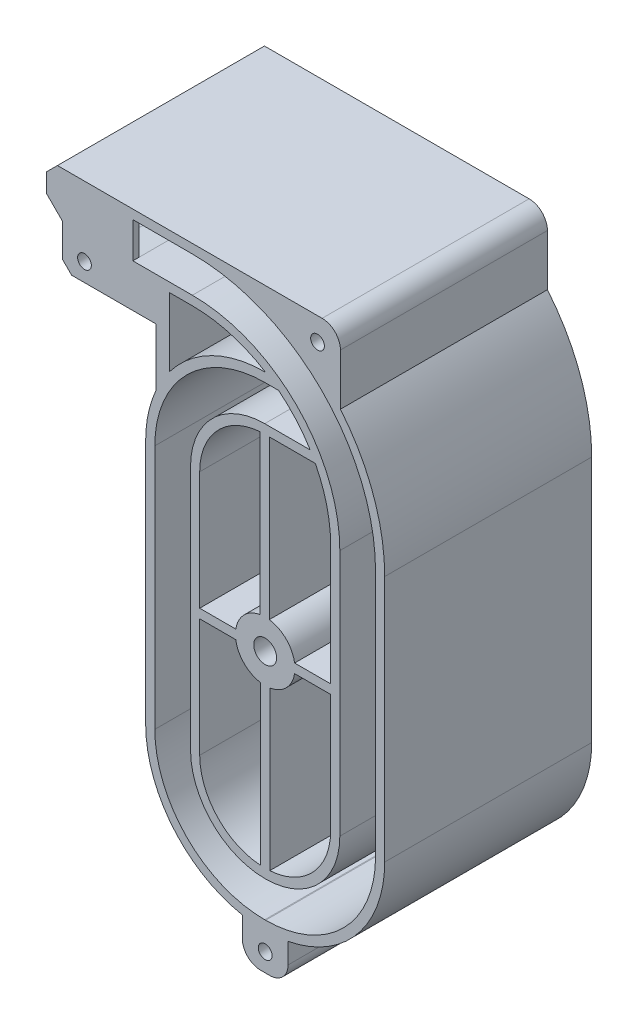
from build123d import *

# Parameters (mm, degrees)
BOSS_EXTRUDE6_DEPTH      = 22.6
BOSS_EXTRUDE6_DEPTH_BACK = 22.6
SKETCH9_R                = 1.5
BOSS_EXTRUDE7_START      = -22.6
BOSS_EXTRUDE7_OUTLINE_R  = 2.5
BOSS_EXTRUDE7_DEPTH      = 45.2
CUT_EXTRUDE1_DEPTH       = 21.2
CUT_EXTRUDE1_DEPTH_BACK  = 21.2
SKETCH9_30_R             = 1.5
BOSS_EXTRUDE8_DEPTH      = 22.6
BOSS_EXTRUDE8_DEPTH_BACK = 22.6
SKETCH9_31_R             = 1.5
FILLET1_R                = 4
CHAMFER1_SIZE            = 2
CHAMFER2_SIZE            = 10
SKETCH11_R               = 2.5
CUT_EXTRUDE5_DEPTH       = 4


# Read off the part's stored shape, not the designer's step: Boss-Extrude7
with BuildPart() as part:
    # Sketch9 → Boss-Extrude6 (new, two sides: drawn at the far end of the back side and taken through both)
    with BuildSketch(Plane.XY.offset(-BOSS_EXTRUDE6_DEPTH_BACK)):
        Polygon((10.55, -1.2), (30.962513099, -1.2), (30.962513099, 6.2), (25.90954056, 6.2), (25.90954056, 8.2), (25.90954056, 18), (9.45, 18), (7.014466094, 15.564466094), (7.014466094, 11.55), (10.55, 8.014466094), align=None)
        with Locations((15.35, 2.8)):
            Circle(SKETCH9_R, mode=Mode.SUBTRACT)
    extrude(amount=BOSS_EXTRUDE6_DEPTH + BOSS_EXTRUDE6_DEPTH_BACK)

    # Boss-Extrude7 outline → Boss-Extrude7 (add)
    with BuildSketch(Plane.XY.offset(BOSS_EXTRUDE7_START)):
        with BuildLine():
            Line((38.90954056, 18), (25.90954056, 18))
            Line((25.90954056, 18), (25.90954056, 16))
            Line((25.90954056, 16), (38.90954056, 16))
            ThreePointArc((38.90954056, 16), (67.193811807, 4.284271247), (78.90954056, -24))
            Line((78.90954056, -24), (78.90954056, -78))
            ThreePointArc((78.90954056, -78), (71.880103308, -94.970562748), (54.90954056, -102))
            Line((54.90954056, -102), (54.709540559, -102))
            ThreePointArc((54.709540559, -102), (37.738977811, -94.970562748), (30.709540559, -78))
            Line((30.709540559, -78), (30.709540559, -24.386722193))
            ThreePointArc((30.709540559, -24.386722193), (37.738977811, -7.416159445), (54.709540559, -0.386722193))
            Line((54.709540559, -0.386722193), (57.736465726, -0.386722193))
            ThreePointArc((57.736465726, -0.386722193), (61.526284336, -3.986931746), (64.638517317, -8.186722193))
            Line((64.638517317, -8.186722193), (54.709540559, -8.186722193))
            ThreePointArc((54.709540559, -8.186722193), (43.254410704, -12.931592338), (38.509540559, -24.386722193))
            Line((38.509540559, -24.386722193), (38.509540559, -78))
            ThreePointArc((38.509540559, -78), (43.254410704, -89.455129855), (54.709540559, -94.2))
            Line((54.709540559, -94.2), (54.90954056, -94.2))
            ThreePointArc((54.90954056, -94.2), (66.364670415, -89.455129855), (71.10954056, -78))
            Line((71.10954056, -78), (71.10954056, -24))
            ThreePointArc((71.10954056, -24), (61.678378914, -1.231161646), (38.90954056, 8.2))
            Line((38.90954056, 8.2), (25.90954056, 8.2))
            Line((25.90954056, 8.2), (25.90954056, 6.2))
            Line((25.90954056, 6.2), (30.962513099, 6.2))
            Line((30.962513099, 6.2), (30.962513099, -13.8))
            ThreePointArc((30.962513099, -13.8), (29.279020372, -18.974823911), (28.709540559, -24.386722193))
            Line((28.709540559, -24.386722193), (28.709540559, -78))
            ThreePointArc((28.709540559, -78), (36.324764249, -96.384776311), (54.709540559, -104))
            Line((54.709540559, -104), (54.90954056, -104))
            ThreePointArc((54.90954056, -104), (73.29431687, -96.384776311), (80.90954056, -78))
            Line((80.90954056, -78), (80.90954056, -24))
            ThreePointArc((80.90954056, -24), (68.608025369, 5.69848481), (38.90954056, 18))
        make_face()
        with BuildLine():
            Line((40.509540559, -78), (40.509540559, -52.193361097))
            Line((40.509540559, -52.193361097), (48.38692427, -52.193361097))
            ThreePointArc((48.38692427, -52.193361097), (50.213346482, -55.789555174), (53.809540559, -57.615977386))
            Line((53.809540559, -57.615977386), (53.809540559, -92.171450173))
            ThreePointArc((53.809540559, -92.171450173), (44.355314369, -87.717509969), (40.509540559, -78))
        make_face(mode=Mode.SUBTRACT)
        with BuildLine():
            Line((61.232156849, -52.193361097), (69.10954056, -52.193361097))
            Line((69.10954056, -52.193361097), (69.10954056, -78))
            ThreePointArc((69.10954056, -78), (65.26376675, -87.717509969), (55.80954056, -92.171450173))
            Line((55.80954056, -92.171450173), (55.809540559, -57.615977386))
            ThreePointArc((55.809540559, -57.615977386), (59.405734637, -55.789555174), (61.232156849, -52.193361097))
        make_face(mode=Mode.SUBTRACT)
        with Locations((54.809540559, -51.193361097)):
            Circle(BOSS_EXTRUDE7_OUTLINE_R, mode=Mode.SUBTRACT)
        with BuildLine():
            Line((48.38692427, -50.193361097), (40.509540559, -50.193361097))
            Line((40.509540559, -50.193361097), (40.509540559, -24.386722193))
            ThreePointArc((40.509540559, -24.386722193), (44.321085429, -14.705813145), (53.709540559, -10.221977225))
            Line((53.709540559, -10.221977225), (53.709540559, -44.787114146))
            ThreePointArc((53.709540559, -44.787114146), (50.177660219, -46.633132538), (48.38692427, -50.193361097))
        make_face(mode=Mode.SUBTRACT)
        with BuildLine():
            ThreePointArc((38.90954056, 6.2), (47.231770136, 5.030681957), (54.909540559, 1.613277807))
            Line((54.909540559, 1.613277807), (54.709540559, 1.613277807))
            ThreePointArc((54.709540559, 1.613277807), (43.121398237, -1.111951356), (33.962513099, -8.716340846))
            Line((33.962513099, -8.716340846), (33.962513099, 6.2))
            Line((33.962513099, 6.2), (38.90954056, 6.2))
        make_face(mode=Mode.SUBTRACT)
        with BuildLine():
            Line((55.709540559, -10.186722193), (65.765328692, -10.186722193))
            ThreePointArc((65.765328692, -10.186722193), (68.261583092, -16.89383372), (69.10954056, -24))
            Line((69.10954056, -24), (69.10954056, -50.193361097))
            Line((69.10954056, -50.193361097), (61.232156849, -50.193361097))
            ThreePointArc((61.232156849, -50.193361097), (59.369856551, -46.561566838), (55.709540559, -44.755970321))
            Line((55.709540559, -44.755970321), (55.709540559, -10.186722193))
        make_face(mode=Mode.SUBTRACT)
    extrude(amount=BOSS_EXTRUDE7_DEPTH)

    # Sketch9<30> → Cut-Extrude1 (cut, two sides: drawn at the far end of the back side and taken through both)
    # profile 1 of 2: a face of its own
    with BuildSketch(Plane.XY.offset(-CUT_EXTRUDE1_DEPTH_BACK)):
        Polygon((19.104002376, 5), (16.104002376, 5), (10.55, 4), (10.55, -1.2), (19.35, -1.2), (19.35, 5.043376018), align=None)
        with Locations((15.35, 2.8)):
            Circle(SKETCH9_30_R, mode=Mode.SUBTRACT)
    # profile 2 of 2: a face of its own
    with BuildSketch(Plane.XY.offset(-CUT_EXTRUDE1_DEPTH_BACK)):
        Polygon((10.55, 5.097056275), (16.104002376, 7), (19.104002376, 7), (25.90954056, 8.2), (25.90954056, 16), (16.104002376, 16), (7.014466094, 14.164466094), (7.014466094, 11.55), (10.55, 8.014466094), align=None)
    extrude(amount=CUT_EXTRUDE1_DEPTH + CUT_EXTRUDE1_DEPTH_BACK, mode=Mode.SUBTRACT)

    # Sketch9<31> → Boss-Extrude8 (add, two sides: drawn at the far end of the back side and taken through both)
    # profile 1 of 2: a face of its own
    with BuildSketch(Plane.XY.offset(-BOSS_EXTRUDE8_DEPTH_BACK)):
        with BuildLine():
            ThreePointArc((38.90954056, 18), (56.770808698, 14.012828104), (71.240841297, 2.808338118))
            Line((71.240841297, 2.808338118), (71.240841297, 8))
            Line((71.240841297, 8), (71.240841297, 18))
            Line((71.240841297, 18), (38.90954056, 18))
        make_face()
        with Locations((66.240841297, 13)):
            Circle(SKETCH9_31_R, mode=Mode.SUBTRACT)
    # profile 2 of 2: a face of its own
    with BuildSketch(Plane.XY.offset(-BOSS_EXTRUDE8_DEPTH_BACK)):
        with BuildLine():
            Line((54.709540559, -104), (54.90954056, -104))
            ThreePointArc((54.90954056, -104), (57.370590519, -103.88326164), (59.809540559, -103.534094854))
            Line((59.809540559, -103.534094854), (59.809540559, -112))
            Line((59.809540559, -112), (49.809540559, -112))
            Line((49.809540559, -112), (49.809540559, -103.534094854))
            ThreePointArc((49.809540559, -103.534094854), (52.2484906, -103.88326164), (54.709540559, -104))
        make_face()
        with Locations((54.809540559, -108)):
            Circle(SKETCH9_31_R, mode=Mode.SUBTRACT)
    extrude(amount=BOSS_EXTRUDE8_DEPTH + BOSS_EXTRUDE8_DEPTH_BACK)

    # Fillet1
    fillet1_edges = [part.edges().sort_by_distance(p)[0] for p in [
        (71.240841297, 18, 0),
        (59.809540559, -112, 0),
        (49.809540559, -112, 0),
    ]]
    fillet(fillet1_edges, radius=FILLET1_R)

    # Chamfer1
    chamfer1_edges = [part.edges().sort_by_distance(p)[0] for p in [
        (10.55, -1.2, -21.9),
        (10.55, -1.2, 21.9),
    ]]
    chamfer(chamfer1_edges, length=CHAMFER1_SIZE)

    # Chamfer2
    # the kernel refuses this chamfer: 10 mm, written as the material it adds along each edge
    with BuildSketch(Plane(origin=(19.35, -1.2, -21.2), x_dir=(0.027495876610586317, 0, 0.9996219169112968), z_dir=(0, 1, 0))) as chamfer2_piece_1_section:
        Polygon((CHAMFER2_SIZE * 0.999621916911, -CHAMFER2_SIZE * 0.0274958766106), (-CHAMFER2_SIZE * 0.0274958766106, -CHAMFER2_SIZE * 0.999621916911), (0, 0), align=None)
    chamfer2_piece_1 = extrude(amount=31.960205898, mode=Mode.PRIVATE)
    chamfer2_piece_1 = split(chamfer2_piece_1, bisect_by=Plane(origin=(10.55, 0.553309939, -18.301201582), z_dir=(1, 0, 0)), keep=Keep.TOP, mode=Mode.PRIVATE)
    chamfer2_piece_1 = split(chamfer2_piece_1, bisect_by=Plane(origin=(12.972143449, -1.622143449, -18.301201582), z_dir=(0.707106781186546, 0.7071067811865491, 0)), keep=Keep.TOP, mode=Mode.PRIVATE)
    chamfer2_piece_1 = split(chamfer2_piece_1, bisect_by=Plane(origin=(13.271329508, 6.029453592, -18.301201582), z_dir=(0.32412836516113813, -0.9460131092632744, 0)), keep=Keep.TOP, mode=Mode.PRIVATE)
    chamfer2_piece_1 = chamfer2_piece_1 - Plane(origin=(15.35, 2.8, -18.301201582), x_dir=(1, 0, 0), z_dir=(0, 0, -1)) * Cylinder(1.5, 104, mode=Mode.PRIVATE)
    chamfer2_piece_1 = split(chamfer2_piece_1, bisect_by=Plane(origin=(15.147596837, 7, -18.301201582), z_dir=(0, -1, 0)), keep=Keep.TOP, mode=Mode.PRIVATE)
    add(chamfer2_piece_1)
    with BuildSketch(Plane(origin=(19.35, -1.2, 21.2), x_dir=(-0.9996219169112968, 0, 0.027495876610586317), z_dir=(0, 1, 0))) as chamfer2_piece_2_section:
        Polygon((CHAMFER2_SIZE * 0.999621916911, -CHAMFER2_SIZE * 0.0274958766106), (-CHAMFER2_SIZE * 0.0274958766106, -CHAMFER2_SIZE * 0.999621916911), (0, 0), align=None)
    chamfer2_piece_2 = extrude(amount=31.960205898, mode=Mode.PRIVATE)
    chamfer2_piece_2 = split(chamfer2_piece_2, bisect_by=Plane(origin=(12.972143449, -1.622143449, 18.301201581), z_dir=(0.707106781186546, 0.7071067811865491, 0)), keep=Keep.TOP, mode=Mode.PRIVATE)
    chamfer2_piece_2 = split(chamfer2_piece_2, bisect_by=Plane(origin=(10.55, 0.553309939, 18.301201581), z_dir=(1, 0, 0)), keep=Keep.TOP, mode=Mode.PRIVATE)
    chamfer2_piece_2 = chamfer2_piece_2 - Plane(origin=(15.35, 2.8, 18.301201581), x_dir=(1, 0, 0), z_dir=(0, 0, -1)) * Cylinder(1.5, 104, mode=Mode.PRIVATE)
    chamfer2_piece_2 = split(chamfer2_piece_2, bisect_by=Plane(origin=(13.271329509, 6.029453592, 18.301201581), z_dir=(0.32412836516113813, -0.9460131092632744, 0)), keep=Keep.TOP, mode=Mode.PRIVATE)
    chamfer2_piece_2 = split(chamfer2_piece_2, bisect_by=Plane(origin=(15.147596837, 7, 18.301201581), z_dir=(0, -1, 0)), keep=Keep.TOP, mode=Mode.PRIVATE)
    add(chamfer2_piece_2)

    # Sketch11 → Cut-Extrude5 (cut)
    with BuildSketch(Plane.XZ.offset(1.2)):
        with Locations(Location((23.35, 10, 0), (0, 0, 270))):
            Circle(SKETCH11_R)
        with Locations(Location((23.35, -10, 0), (0, 0, 270))):
            Circle(SKETCH11_R)
    extrude(amount=-CUT_EXTRUDE5_DEPTH, mode=Mode.SUBTRACT)


solid = part.part
